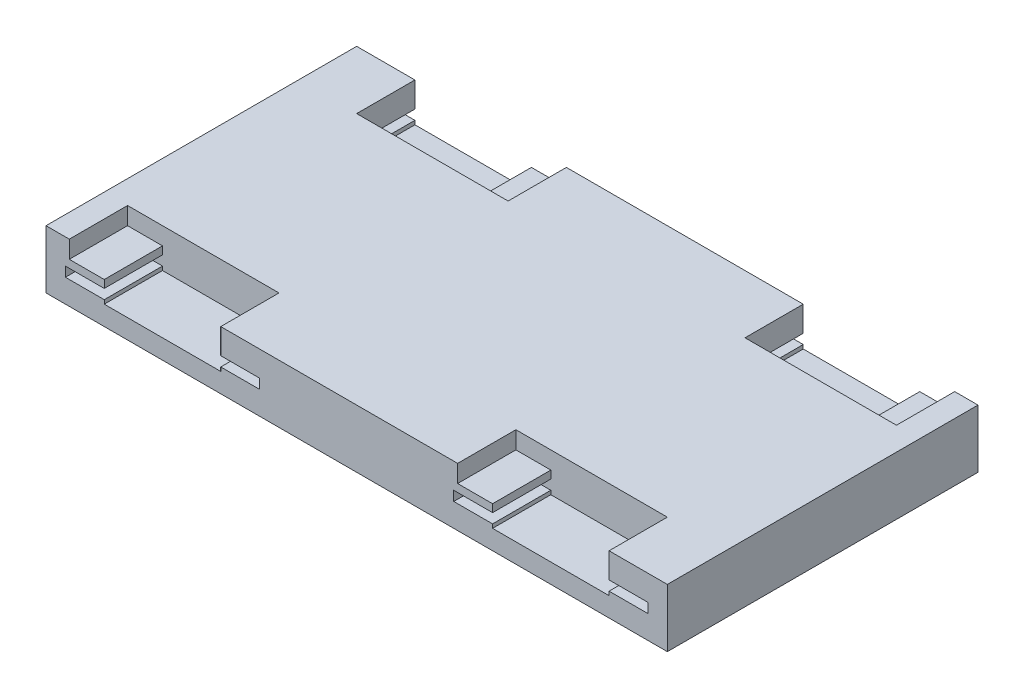
from build123d import *

# Parameters (mm, degrees)
SKETCH1_W               = 320
SKETCH1_H               = 160
BOSS_EXTRUDE1_DEPTH     = 20
SKETCH2_W               = 60
SKETCH2_H               = 30
CUT_EXTRUDE1_DEPTH      = 28
SKETCH3_W               = 20
SKETCH3_H               = 5
CUT_EXTRUDE3_DEPTH      = 30
MIRROR3_COPY_1_SKETCH_W = 60
MIRROR3_COPY_1_SKETCH_H = 30
MIRROR3_COPY_1_DEPTH    = 28
MIRROR3_COPY_2_SKETCH_W = 20
MIRROR3_COPY_2_SKETCH_H = 5
MIRROR3_COPY_2_DEPTH    = 30
MIRROR3_COPY_3_SKETCH_W = 60
MIRROR3_COPY_3_SKETCH_H = 30
MIRROR3_COPY_3_DEPTH    = 28
MIRROR3_COPY_4_SKETCH_W = 20
MIRROR3_COPY_4_SKETCH_H = 5
MIRROR3_COPY_4_DEPTH    = 30
SKETCH5_W               = 18
SKETCH5_H               = 9
CUT_EXTRUDE4_DEPTH      = 30
SKETCH6_W               = 18
SKETCH6_H               = 9
CUT_EXTRUDE5_DEPTH      = 30
SKETCH8_W               = 18
SKETCH8_H               = 9
CUT_EXTRUDE6_DEPTH      = 30
SKETCH9_W               = 18
SKETCH9_H               = 9
CUT_EXTRUDE7_DEPTH      = 30
SKETCH10_W              = 320
SKETCH10_H              = 160
BOSS_EXTRUDE2_DEPTH     = 10


with BuildPart() as part:
    # Sketch1 → Boss-Extrude1 (new body)
    with BuildSketch(Plane(origin=(0, 0, 0), x_dir=(1, 0, 0), z_dir=(0, 1, 0))):
        Rectangle(SKETCH1_W, SKETCH1_H)
    extrude(amount=BOSS_EXTRUDE1_DEPTH)

    # Sketch2 → Cut-Extrude1 (cut)
    with BuildSketch(Plane(origin=(0, 20, 0), x_dir=(1, 0, 0), z_dir=(0, 1, 0))):
        with Locations((-100, -65)):
            Rectangle(SKETCH2_W, SKETCH2_H)
    cut_extrude1 = extrude(amount=-CUT_EXTRUDE1_DEPTH, mode=Mode.SUBTRACT)

    # Sketch3 → Cut-Extrude3 (cut)
    with BuildSketch(Plane.XY.offset(80)):
        with Locations((-140, 4.5)):
            Rectangle(SKETCH3_W, SKETCH3_H)
        with Locations((-60, 4.5)):
            Rectangle(SKETCH3_W, SKETCH3_H)
    cut_extrude3 = extrude(amount=-CUT_EXTRUDE3_DEPTH, mode=Mode.SUBTRACT)

    # Mirror2: Cut-Extrude1, Cut-Extrude3 across plane
    add(cut_extrude1.mirror(Plane(origin=(0, 0, 0), x_dir=(0, 0, 1), z_dir=(1, 0, 0))), mode=Mode.SUBTRACT)
    add(cut_extrude3.mirror(Plane(origin=(0, 0, 0), x_dir=(0, 0, 1), z_dir=(1, 0, 0))), mode=Mode.SUBTRACT)

    # Mirror3 copy 1 sketch → Mirror3 copy 1 (cut)
    with BuildSketch(Plane(origin=(0, 20, 0), x_dir=(-1, 0, 0), z_dir=(0, 1, 0))):
        with Locations((-100, -65)):
            Rectangle(MIRROR3_COPY_1_SKETCH_W, MIRROR3_COPY_1_SKETCH_H)
    extrude(amount=-MIRROR3_COPY_1_DEPTH, mode=Mode.SUBTRACT)

    # Mirror3 copy 2 sketch → Mirror3 copy 2 (cut)
    with BuildSketch(Plane(origin=(0, 0, -80), x_dir=(-1, 0, 0), z_dir=(0, 0, -1))):
        with Locations((-140, 4.5)):
            Rectangle(MIRROR3_COPY_2_SKETCH_W, MIRROR3_COPY_2_SKETCH_H)
        with Locations((-60, 4.5)):
            Rectangle(MIRROR3_COPY_2_SKETCH_W, MIRROR3_COPY_2_SKETCH_H)
    extrude(amount=-MIRROR3_COPY_2_DEPTH, mode=Mode.SUBTRACT)

    # Mirror3 copy 3 sketch → Mirror3 copy 3 (cut)
    with BuildSketch(Plane(origin=(0, 20, 0), x_dir=(1, 0, 0), z_dir=(0, 1, 0))):
        with Locations((-100, 65)):
            Rectangle(MIRROR3_COPY_3_SKETCH_W, MIRROR3_COPY_3_SKETCH_H)
    extrude(amount=-MIRROR3_COPY_3_DEPTH, mode=Mode.SUBTRACT)

    # Mirror3 copy 4 sketch → Mirror3 copy 4 (cut)
    with BuildSketch(Plane(origin=(0, 0, -80), x_dir=(1, 0, 0), z_dir=(0, 0, -1))):
        with Locations((-140, -4.5)):
            Rectangle(MIRROR3_COPY_4_SKETCH_W, MIRROR3_COPY_4_SKETCH_H)
        with Locations((-60, -4.5)):
            Rectangle(MIRROR3_COPY_4_SKETCH_W, MIRROR3_COPY_4_SKETCH_H)
    extrude(amount=-MIRROR3_COPY_4_DEPTH, mode=Mode.SUBTRACT)

    # Sketch5 → Cut-Extrude4 (cut)
    with BuildSketch(Plane.XY.offset(80)):
        with Locations((-139, 15.5)):
            Rectangle(SKETCH5_W, SKETCH5_H)
    extrude(amount=-CUT_EXTRUDE4_DEPTH, mode=Mode.SUBTRACT)

    # Sketch6 → Cut-Extrude5 (cut)
    with BuildSketch(Plane.XY.offset(80)):
        with Locations((61, 15.5)):
            Rectangle(SKETCH6_W, SKETCH6_H)
    extrude(amount=-CUT_EXTRUDE5_DEPTH, mode=Mode.SUBTRACT)

    # Sketch8 → Cut-Extrude6 (cut)
    with BuildSketch(Plane(origin=(0, 0, -80), x_dir=(-1, 0, 0), z_dir=(0, 0, -1))):
        with Locations((-139, 15.5)):
            Rectangle(SKETCH8_W, SKETCH8_H)
    extrude(amount=-CUT_EXTRUDE6_DEPTH, mode=Mode.SUBTRACT)

    # Sketch9 → Cut-Extrude7 (cut)
    with BuildSketch(Plane(origin=(0, 0, -80), x_dir=(-1, 0, 0), z_dir=(0, 0, -1))):
        with Locations((61, 15.5)):
            Rectangle(SKETCH9_W, SKETCH9_H)
    extrude(amount=-CUT_EXTRUDE7_DEPTH, mode=Mode.SUBTRACT)

    # Sketch10 → Boss-Extrude2 (add)
    with BuildSketch(Plane.XZ):
        Rectangle(SKETCH10_W, SKETCH10_H)
    extrude(amount=BOSS_EXTRUDE2_DEPTH)


solid = part.part
